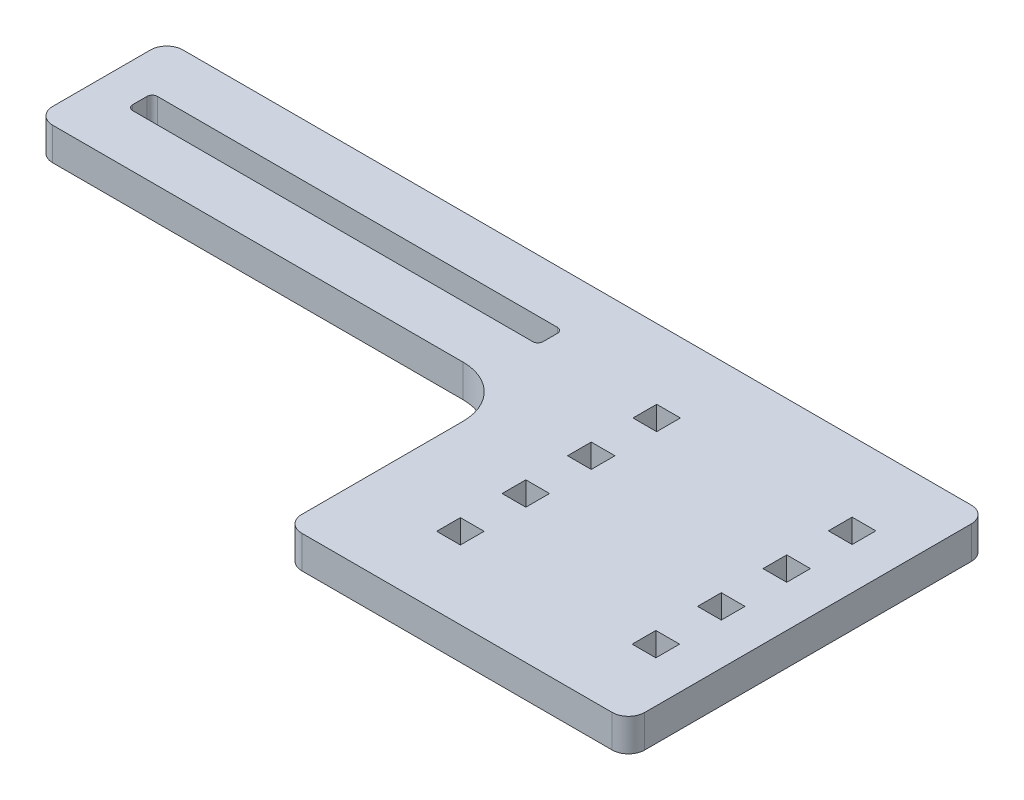
from build123d import *

# Parameters (mm, degrees)
SKETCH1_W           = 80
SKETCH1_H           = 4.819787269
SKETCH1_W_2         = 4.6228
SKETCH1_H_2         = 4.6228
BOSS_EXTRUDE1_DEPTH = 6.35
FILLET2_R           = 3.175
FILLET3_R           = 3.175
FILLET4_R           = 10
FILLET5_R           = 1


with BuildPart() as part:
    # Sketch1 → Boss-Extrude1 (new body)
    with BuildSketch(Plane(origin=(0, 0, 0), x_dir=(1, 0, 0), z_dir=(0, 1, 0))):
        Polygon((0, 0), (160, 0), (160, -70), (93.1472, -70), (93.1472, -25.4), (0, -25.4), align=None)
        with Locations((47.5, -12.740106366)):
            Rectangle(SKETCH1_W, SKETCH1_H, mode=Mode.SUBTRACT)
        with Locations((149.5586, -15.96068286)):
            Rectangle(SKETCH1_W_2, SKETCH1_H_2, mode=Mode.SUBTRACT)
        with Locations((149.5586, -28.71348286)):
            Rectangle(SKETCH1_W_2, SKETCH1_H_2, mode=Mode.SUBTRACT)
        with Locations((149.5586, -41.46628286)):
            Rectangle(SKETCH1_W_2, SKETCH1_H_2, mode=Mode.SUBTRACT)
        with Locations((111.4586, -15.96068286)):
            Rectangle(SKETCH1_W_2, SKETCH1_H_2, mode=Mode.SUBTRACT)
        with Locations((111.4586, -28.71348286)):
            Rectangle(SKETCH1_W_2, SKETCH1_H_2, mode=Mode.SUBTRACT)
        with Locations((111.4586, -41.46628286)):
            Rectangle(SKETCH1_W_2, SKETCH1_H_2, mode=Mode.SUBTRACT)
        with Locations((149.5586, -54.21908286)):
            Rectangle(SKETCH1_W_2, SKETCH1_H_2, mode=Mode.SUBTRACT)
        with Locations((111.4586, -54.21908286)):
            Rectangle(SKETCH1_W_2, SKETCH1_H_2, mode=Mode.SUBTRACT)
    extrude(amount=BOSS_EXTRUDE1_DEPTH)

    # Fillet2
    fillet2_edges = [part.edges().sort_by_distance(p)[0] for p in [
        (0, 3.175, 25.4),
    ]]
    fillet(fillet2_edges, radius=FILLET2_R)

    # Fillet3
    fillet3_edges = [part.edges().sort_by_distance(p)[0] for p in [
        (93.1472, 3.175, 70),
        (160, 3.175, 70),
        (160, 3.175, 0),
        (0, 3.175, 0),
    ]]
    fillet(fillet3_edges, radius=FILLET3_R)

    # Fillet4
    fillet4_edges = [part.edges().sort_by_distance(p)[0] for p in [
        (93.1472, 3.175, 25.4),
    ]]
    fillet(fillet4_edges, radius=FILLET4_R)

    # Fillet5
    fillet5_edges = [part.edges().sort_by_distance(p)[0] for p in [
        (87.5, 3.175, 15.15),
        (87.5, 3.175, 10.330212731),
        (7.5, 3.175, 10.330212731),
        (7.5, 3.175, 15.15),
    ]]
    fillet(fillet5_edges, radius=FILLET5_R)


solid = part.part
